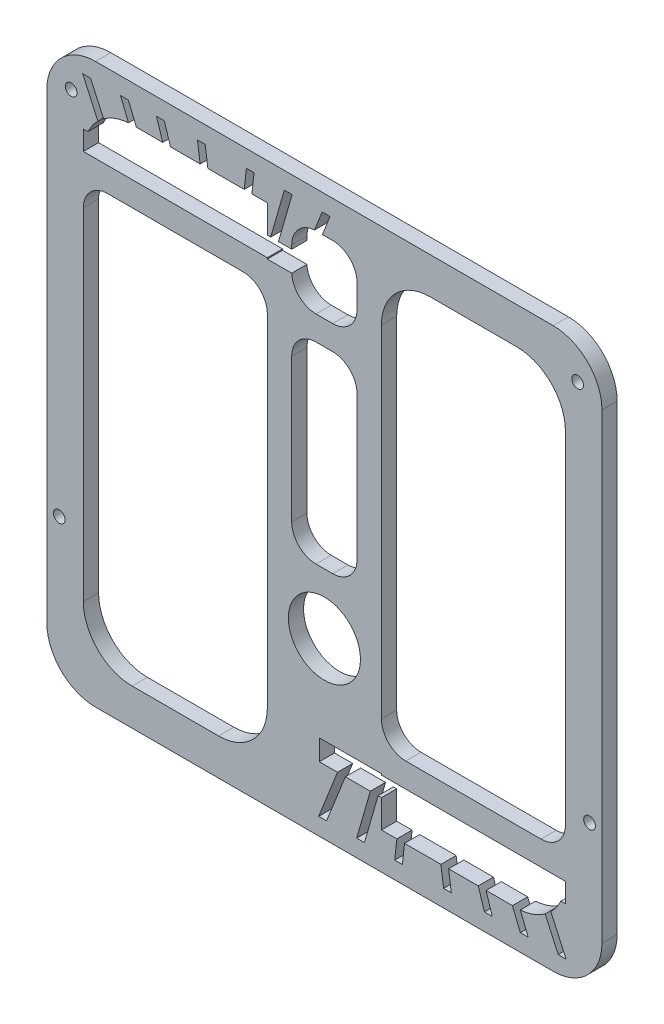
from build123d import *

# Parameters (mm, degrees)
SKETCH1_W           = 57.8674
SKETCH1_H           = 58.2902
SKETCH1_W_2         = 50.2474
SKETCH1_H_2         = 50.6702
BOSS_EXTRUDE1_DEPTH = 1.5875
FILLET3_R           = 5.08
SKETCH6_W           = 11.8934
SKETCH6_H           = 50.6702
SKETCH6_R           = 3.7592
BOSS_EXTRUDE2_DEPTH = 1.5875
FINS_CUT_DEPTH      = 2.54
SKETCH7_W           = 19.177
SKETCH7_H           = 2.54
BOSS_EXTRUDE3_DEPTH = 1.5875
FILLET1_R           = 5.08
FILLET4_R           = 5.08
SKETCH8_W           = 6.8134
SKETCH8_H           = 7.493
SKETCH8_H_2         = 20.0392
CUT_EXTRUDE5_DEPTH  = 1.5875
FILLET5_R           = 2.54
FILLET6_R           = 2.54
FILLET7_R           = 2.54
SKETCH9_R           = 0.6096
CUT_EXTRUDE6_DEPTH  = 1.5875


with BuildPart() as part:
    # Sketch1 → Boss-Extrude1 (new body)
    with BuildSketch(Plane.XY):
        with Locations((12.492699517, 17.740517652)):
            Rectangle(SKETCH1_W, SKETCH1_H)
        with Locations((12.492699517, 17.740517652)):
            Rectangle(SKETCH1_W_2, SKETCH1_H_2, mode=Mode.SUBTRACT)
    extrude(amount=BOSS_EXTRUDE1_DEPTH)

    # Fillet3
    fillet3_edges = [part.edges().sort_by_distance(p)[0] for p in [
        (-12.631000483, 43.075617652, 0.79375),
        (-12.631000483, -7.594582348, 0.79375),
        (37.616399517, -7.594582348, 0.79375),
        (37.616399517, 43.075617652, 0.79375),
    ]]
    fillet(fillet3_edges, radius=FILLET3_R)

    # Sketch6 → Boss-Extrude2 (add)
    with BuildSketch(Plane.XY.offset(1.5875)):
        with Locations((12.492699517, 17.740517652)):
            Rectangle(SKETCH6_W, SKETCH6_H)
        with Locations((12.492699517, 6.704217652)):
            Circle(SKETCH6_R, mode=Mode.SUBTRACT)
    extrude(amount=-BOSS_EXTRUDE2_DEPTH)

    # Sketch4 → Fins cut (cut)
    with BuildSketch(Plane.XY.offset(1.5875)):
        with BuildLine():
            Line((-12.149382698, 40.154617652), (-12.631000483, 40.154617652))
            Line((-12.631000483, 40.154617652), (-12.631000483, 37.995617652))
            ThreePointArc((-12.631000483, 37.995617652), (-12.509134288, 39.101650731), (-12.149382698, 40.154617652))
        make_face()
        Polygon((6.545999517, 40.154617652), (6.545999517, 37.995617652), (13.022999517, 37.995617652), (13.022999517, 40.154617652), (11.126956513, 40.154617652), (13.082688495, 45.107617652), (12.263436468, 45.107617652), (10.307704486, 40.154617652), (7.705138754, 40.154617652), (9.127606772, 45.107617652), (8.317171321, 45.107617652), (6.894703303, 40.154617652), align=None)
        with BuildLine():
            Line((-12.701104011, 45.107617652), (-11.115909096, 41.614709607))
            ThreePointArc((-11.115909096, 41.614709607), (-10.827291356, 41.877926001), (-10.5193022, 42.118187835))
            Line((-10.5193022, 42.118187835), (-11.876002372, 45.107617652))
            Line((-11.876002372, 45.107617652), (-12.701104011, 45.107617652))
        make_face()
        Polygon((4.93970469, 43.075617652), (5.163773621, 45.107617652), (4.362066012, 45.107617652), (4.137997081, 43.075617652), align=None)
        Polygon((18.439399517, -2.514582348), (11.962399517, -2.514582348), (11.962399517, -4.673582348), (13.858442521, -4.673582348), (11.902710539, -9.626582348), (12.721962566, -9.626582348), (14.677694548, -4.673582348), (17.28026028, -4.673582348), (15.857792262, -9.626582348), (16.668227713, -9.626582348), (18.090695731, -4.673582348), (18.439399517, -4.673582348), align=None)
        with BuildLine():
            Line((-8.755473368, 45.107617652), (-7.926673781, 43.061707818))
            ThreePointArc((-7.926673781, 43.061707818), (-7.738965845, 43.072139003), (-7.551000483, 43.075617652))
            Line((-7.551000483, 43.075617652), (-7.112090465, 43.075617652))
            Line((-7.112090465, 43.075617652), (-7.935255168, 45.107617652))
            Line((-7.935255168, 45.107617652), (-8.755473368, 45.107617652))
        make_face()
        with BuildLine():
            Line((37.616399517, -4.673582348), (37.616399517, -2.514582348))
            ThreePointArc((37.616399517, -2.514582348), (37.494533322, -3.620615427), (37.134781733, -4.673582348))
            Line((37.134781733, -4.673582348), (37.616399517, -4.673582348))
        make_face()
        Polygon((0.346695583, 43.075617652), (0.065397546, 45.107617652), (-0.737192749, 45.107617652), (-0.455894712, 43.075617652), align=None)
        with BuildLine():
            Line((37.686503045, -9.626582348), (36.10130813, -6.133674303))
            ThreePointArc((36.10130813, -6.133674303), (35.81269039, -6.396890696), (35.504701234, -6.637152531))
            Line((35.504701234, -6.637152531), (36.861401406, -9.626582348))
            Line((36.861401406, -9.626582348), (37.686503045, -9.626582348))
        make_face()
        Polygon((20.045694344, -7.594582348), (19.821625413, -9.626582348), (20.623333022, -9.626582348), (20.847401953, -7.594582348), align=None)
        Polygon((-5.00684021, 45.107617652), (-4.360824225, 43.075617652), (-3.54812875, 43.075617652), (-4.194144736, 45.107617652), align=None)
        Polygon((24.638703451, -7.594582348), (24.920001488, -9.626582348), (25.722591783, -9.626582348), (25.441293746, -7.594582348), align=None)
        with BuildLine():
            Line((33.740872402, -9.626582348), (32.912072815, -7.580672514))
            ThreePointArc((32.912072815, -7.580672514), (32.72436488, -7.591103698), (32.536399517, -7.594582348))
            Line((32.536399517, -7.594582348), (32.097489499, -7.594582348))
            Line((32.097489499, -7.594582348), (32.920654202, -9.626582348))
            Line((32.920654202, -9.626582348), (33.740872402, -9.626582348))
        make_face()
        Polygon((28.533527785, -7.594582348), (29.17954377, -9.626582348), (29.992239244, -9.626582348), (29.346223259, -7.594582348), align=None)
    extrude(amount=-FINS_CUT_DEPTH, mode=Mode.SUBTRACT)

    # Sketch7 → Boss-Extrude3 (add)
    with BuildSketch(Plane.XY.offset(1.5875)):
        with Locations((-3.042500483, 36.852617652)):
            Rectangle(SKETCH7_W, SKETCH7_H)
        with Locations((28.027899517, -1.371582348)):
            Rectangle(SKETCH7_W, SKETCH7_H)
    extrude(amount=-BOSS_EXTRUDE3_DEPTH)

    # Fillet1
    fillet1_edges = [part.edges().sort_by_distance(p)[0] for p in [
        (-16.441000483, 46.885617652, 0.79375),
        (41.426399517, 46.885617652, 0.79375),
        (41.426399517, -11.404582348, 0.79375),
        (-16.441000483, -11.404582348, 0.79375),
    ]]
    fillet(fillet1_edges, radius=FILLET1_R)

    # Fillet4
    fillet4_edges = [part.edges().sort_by_distance(p)[0] for p in [
        (6.545999517, -7.594582348, 0.79375),
        (18.439399517, 43.075617652, 0.79375),
    ]]
    fillet(fillet4_edges, radius=FILLET4_R)

    # Sketch8 → Cut-Extrude5 (cut)
    with BuildSketch(Plane.XY.offset(1.5875)):
        with Locations((12.492699517, 39.329117652)):
            Rectangle(SKETCH8_W, SKETCH8_H)
        with Locations((12.492699517, 23.023017652)):
            Rectangle(SKETCH8_W, SKETCH8_H_2)
    extrude(amount=-CUT_EXTRUDE5_DEPTH, mode=Mode.SUBTRACT)

    # Fillet5
    # the kernel refuses this fillet: 2.54 mm, written as the material it adds along each edge
    with BuildSketch(Plane(origin=(9.085999517, 43.075617652, 1.5875), x_dir=(1, 0, 0), z_dir=(0, 0, -1))) as fillet5_piece_1:
        with BuildLine():
            CenterArc((2.54, 2.534640638), FILLET5_R, 180, 86.277337152)
            Line((0, 2.534640638), (-0.0508, 2.534640638))
            Line((-0.0508, 2.534640638), (-0.0508, 0))
            Line((-0.0508, 0), (0, -0.0508))
            ThreePointArc((0, -0.0508), (1.187542685, -0.0508), (2.371787076, -0.050692813))
            Line((2.371787076, -0.050692813), (2.375085369, 0))
        make_face()
    extrude(amount=1.5875)
    with BuildSketch(Plane(origin=(15.899399517, 43.075617652, 1.5875), x_dir=(0, -1, 0), z_dir=(0, 0, -1)), Plane(origin=(9.085999517, 13.003417652, 1.5875), x_dir=(0, 1, 0), z_dir=(0, 0, -1)), Plane(origin=(15.899399517, 13.003417652, 1.5875), x_dir=(-1, 0, 0), z_dir=(0, 0, -1))) as fillet5_piece_2:
        with BuildLine():
            CenterArc((FILLET5_R, FILLET5_R), FILLET5_R, 180, 90)
            Line((0, FILLET5_R), (-FILLET5_R * 0.02, FILLET5_R))
            Line((-FILLET5_R * 0.02, FILLET5_R), (-FILLET5_R * 0.02, -FILLET5_R * 0.02))
            Line((-FILLET5_R * 0.02, -FILLET5_R * 0.02), (FILLET5_R, -FILLET5_R * 0.02))
            Line((FILLET5_R, -FILLET5_R * 0.02), (FILLET5_R, 0))
        make_face()
    extrude(amount=1.5875)

    # Fillet6
    fillet6_edges = [part.edges().sort_by_distance(p)[0] for p in [
        (6.545999517, 35.582617652, 0.79375),
        (-12.631000483, 35.582617652, 0.79375),
        (18.439399517, -0.101582348, 0.79375),
        (37.616399517, -0.101582348, 0.79375),
    ]]
    fillet(fillet6_edges, radius=FILLET6_R)

    # Fillet7
    # the kernel refuses this fillet: 2.54 mm, written as the material it adds along each edge
    with BuildSketch(Plane(origin=(9.085999517, 35.582617652, 1.5875), x_dir=(1, 0, 0), z_dir=(0, 0, -1))) as fillet7_piece_1:
        with BuildLine():
            CenterArc((2.536823013, -2.54), FILLET7_R, 90, 87.134016017)
            Line((0, -2.413), (-0.05073646, -2.41046))
            ThreePointArc((-0.05073646, -2.41046), (-0.0508, -1.2065), (-0.0508, 0))
            Line((-0.0508, 0), (0, 0.0508))
            Line((0, 0.0508), (2.536823013, 0.0508))
            Line((2.536823013, 0.0508), (2.536823013, 0))
        make_face()
    extrude(amount=1.5875)
    with BuildSketch(Plane(origin=(15.899399517, 35.582617652, 1.5875), x_dir=(0, 1, 0), z_dir=(0, 0, -1)), Plane(origin=(15.899399517, 33.042617652, 1.5875), x_dir=(-1, 0, 0), z_dir=(0, 0, -1))) as fillet7_piece_2:
        with BuildLine():
            CenterArc((FILLET7_R, -FILLET7_R), FILLET7_R, 90, 90)
            Line((0, -FILLET7_R), (-FILLET7_R * 0.02, -FILLET7_R))
            Line((-FILLET7_R * 0.02, -FILLET7_R), (-FILLET7_R * 0.02, FILLET7_R * 0.02))
            Line((-FILLET7_R * 0.02, FILLET7_R * 0.02), (FILLET7_R, FILLET7_R * 0.02))
            Line((FILLET7_R, FILLET7_R * 0.02), (FILLET7_R, 0))
        make_face()
    extrude(amount=1.5875)
    with BuildSketch(Plane(origin=(9.085999517, 33.042617652, 1.5875), x_dir=(1, 0, 0), z_dir=(0, 0, -1))) as fillet7_piece_3:
        with BuildLine():
            CenterArc((FILLET7_R, FILLET7_R), FILLET7_R, 180, 90)
            Line((0, FILLET7_R), (-FILLET7_R * 0.02, FILLET7_R))
            Line((-FILLET7_R * 0.02, FILLET7_R), (-FILLET7_R * 0.02, -FILLET7_R * 0.02))
            Line((-FILLET7_R * 0.02, -FILLET7_R * 0.02), (FILLET7_R, -FILLET7_R * 0.02))
            Line((FILLET7_R, -FILLET7_R * 0.02), (FILLET7_R, 0))
        make_face()
    extrude(amount=1.5875)

    # Sketch9 → Cut-Extrude6 (cut)
    with BuildSketch(Plane.XY.offset(1.5875)):
        with Locations((-13.901000483, 43.075617652)):
            Circle(SKETCH9_R)
        with Locations((38.886399517, 43.075617652)):
            Circle(SKETCH9_R)
        with Locations((40.130999517, 3.910217652)):
            Circle(SKETCH9_R)
        with Locations((-15.145600483, 3.910217652)):
            Circle(SKETCH9_R)
    extrude(amount=-CUT_EXTRUDE6_DEPTH, mode=Mode.SUBTRACT)


solid = part.part
